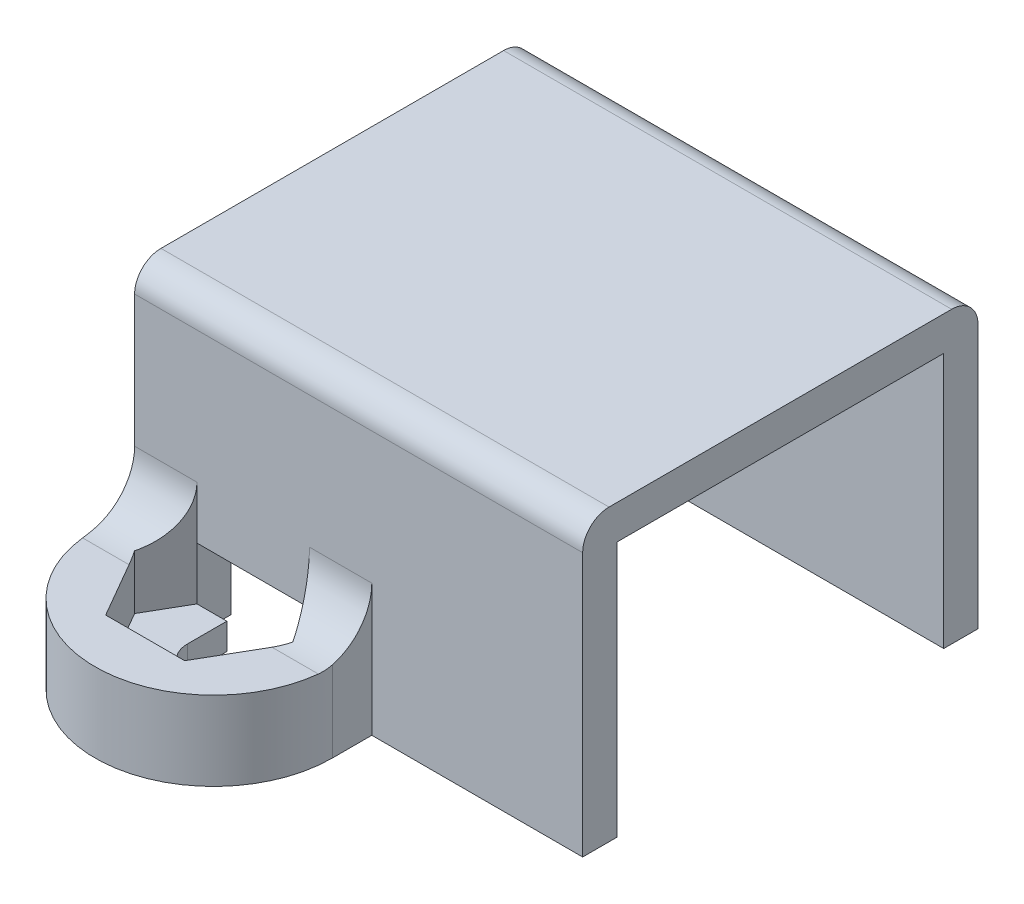
from build123d import *

# Parameters (mm, degrees)
CROQUIS1_W              = 17
CROQUIS1_H              = 27
SALIENTE_EXTRUIR1_DEPTH = 11
CROQUIS2_W              = 17
CROQUIS2_H              = 6
CORTAR_EXTRUIR1_DEPTH   = 6
CROQUIS3_W              = 8
CROQUIS3_H              = 5
CORTAR_EXTRUIR2_DEPTH   = 6
CROQUIS4_W              = 8
CROQUIS4_H              = 5
CORTAR_EXTRUIR3_DEPTH   = 6
CORTAR_EXTRUIR8_DEPTH   = 6
CORTAR_EXTRUIR16_DEPTH  = 2
CORTAR_EXTRUIR17_DEPTH  = 2
CORTAR_EXTRUIR18_DEPTH  = 2
REDONDEO5_START         = -1
REDONDEO5_DEPTH         = 1.04658
REDONDEO5_START_2       = -7.65058
REDONDEO5_2_DEPTH       = 0.804
REDONDEO5_START_3       = -1.866025504
REDONDEO5_3_DEPTH       = 2.366025504
REDONDEO5_START_4       = -8.5
REDONDEO5_4_DEPTH       = 0.84942
REDONDEO5_START_5       = -6.84658
REDONDEO5_5_DEPTH       = 0.712605404
REDONDEO5_START_6       = 3
REDONDEO5_6_DEPTH       = 3
CORTAR_EXTRUIR19_DEPTH  = 17
CORTAR_EXTRUIR20_START  = -10
CORTAR_EXTRUIR20_DEPTH  = 10
REDONDEO6_R             = 1
CORTAR_EXTRUIR21_DEPTH  = 1
CORTAR_EXTRUIR22_DEPTH  = 1
CORTAR_EXTRUIR26_DEPTH  = 1.3
CROQUIS17_W             = 4.267949192
CROQUIS17_H             = 2
CORTAR_EXTRUIR27_DEPTH  = 1.3
CROQUIS19_W             = 4.267949192
CROQUIS19_H             = 1
CORTAR_EXTRUIR28_DEPTH  = 1.3
CROQUIS20_W             = 4.267949192
CROQUIS20_H             = 1
CORTAR_EXTRUIR29_DEPTH  = 1.3


with BuildPart() as part:
    # Croquis1 → Saliente-Extruir1 (new body)
    with BuildSketch(Plane(origin=(0, 0, 0), x_dir=(1, 0, 0), z_dir=(0, 1, 0))):
        Rectangle(CROQUIS1_W, CROQUIS1_H)
    extrude(amount=SALIENTE_EXTRUIR1_DEPTH)

    # Croquis2 → Cortar-Extruir1 (cut)
    with BuildSketch(Plane(origin=(0, 11, 0), x_dir=(1, 0, 0), z_dir=(0, 1, 0))):
        with Locations((0, 10.5)):
            Rectangle(CROQUIS2_W, CROQUIS2_H)
        with Locations((0, -10.5)):
            Rectangle(CROQUIS2_W, CROQUIS2_H)
    extrude(amount=-CORTAR_EXTRUIR1_DEPTH, mode=Mode.SUBTRACT)

    # Croquis3 → Cortar-Extruir2 (cut)
    with BuildSketch(Plane.XY.offset(13.5)):
        with Locations((4.5, 2.5)):
            Rectangle(CROQUIS3_W, CROQUIS3_H)
    extrude(amount=-CORTAR_EXTRUIR2_DEPTH, mode=Mode.SUBTRACT)

    # Croquis4 → Cortar-Extruir3 (cut)
    with BuildSketch(Plane(origin=(0, 0, -13.5), x_dir=(-1, 0, 0), z_dir=(0, 0, -1))):
        with Locations((-4.5, 2.5)):
            Rectangle(CROQUIS4_W, CROQUIS4_H)
    extrude(amount=-CORTAR_EXTRUIR3_DEPTH, mode=Mode.SUBTRACT)

    # Croquis5 → Cortar-Extruir8 (cut)
    with BuildSketch(Plane(origin=(0, 5, 0), x_dir=(1, 0, 0), z_dir=(0, 1, 0))):
        with BuildLine():
            Line((-8.5, 13.5), (-8.5, 9))
            ThreePointArc((-8.5, 9), (-7.181980515, 12.181980515), (-4, 13.5))
            Line((-4, 13.5), (-8.5, 13.5))
        make_face()
        with BuildLine():
            Line((0.5, 13.5), (-4, 13.5))
            ThreePointArc((-4, 13.5), (-0.818019485, 12.181980515), (0.5, 9))
            Line((0.5, 9), (0.5, 13.5))
        make_face()
        with BuildLine():
            ThreePointArc((-4, -13.5), (-7.181980515, -12.181980515), (-8.5, -9))
            Line((-8.5, -9), (-8.5, -13.5))
            Line((-8.5, -13.5), (-4, -13.5))
        make_face()
        with BuildLine():
            ThreePointArc((0.5, -9), (-0.818019485, -12.181980515), (-4, -13.5))
            Line((-4, -13.5), (0.5, -13.5))
            Line((0.5, -13.5), (0.5, -9))
        make_face()
    extrude(amount=-CORTAR_EXTRUIR8_DEPTH, mode=Mode.SUBTRACT)

    # Croquis7 → Cortar-Extruir16 (cut)
    with BuildSketch(Plane(origin=(0, 5, 0), x_dir=(1, 0, 0), z_dir=(0, 1, 0))):
        with BuildLine():
            Line((-8.5, 7.5), (-8.5, 9))
            ThreePointArc((-8.5, 9), (-4, 13.5), (0.5, 9))
            Line((0.5, 9), (0.5, 7.5))
            Line((0.5, 7.5), (-8.5, 7.5))
        make_face()
        with BuildLine():
            Line((-8.5, -9), (-8.5, -7.5))
            Line((-8.5, -7.5), (0.5, -7.5))
            Line((0.5, -7.5), (0.5, -9))
            ThreePointArc((0.5, -9), (-4, -13.5), (-8.5, -9))
        make_face()
    extrude(amount=-CORTAR_EXTRUIR16_DEPTH, mode=Mode.SUBTRACT)

    # Croquis10 → Cortar-Extruir17 (cut)
    with BuildSketch(Plane(origin=(0, 3, 0), x_dir=(1, 0, 0), z_dir=(0, 1, 0))):
        Polygon((-6.133974596, 7.5), (-1.866025404, 7.5), (-1, 9), (-2.5, 11.598076211), (-5.5, 11.598076211), (-7, 9), align=None)
    extrude(amount=-CORTAR_EXTRUIR17_DEPTH, mode=Mode.SUBTRACT)

    # Croquis11 → Cortar-Extruir18 (cut)
    with BuildSketch(Plane(origin=(0, 3, 0), x_dir=(1, 0, 0), z_dir=(0, 1, 0))):
        Polygon((-6.133974596, -7.5), (-1.866025404, -7.5), (-1, -9), (-2.5, -11.598076211), (-5.5, -11.598076211), (-7, -9), align=None)
    extrude(amount=-CORTAR_EXTRUIR18_DEPTH, mode=Mode.SUBTRACT)

    # Redondeo5: read off the stored shape, not the designer's step
    # Redondeo5 outline → Redondeo5 (add)
    with BuildSketch(Plane.YZ.offset(REDONDEO5_START)):
        with BuildLine():
            Line((3, 7.5), (5, 7.5))
            ThreePointArc((5, 7.5), (3.585786438, 8.085786438), (3, 9.5))
            Line((3, 9.5), (3, 7.5))
        make_face()
        with BuildLine():
            ThreePointArc((3, -9.5), (3.585786438, -8.085786438), (5, -7.5))
            Line((5, -7.5), (3, -7.5))
            Line((3, -7.5), (3, -9.5))
        make_face()
    extrude(amount=REDONDEO5_DEPTH)

    # Redondeo5 2 outline → Redondeo5 2 (add)
    with BuildSketch(Plane.YZ.offset(REDONDEO5_START_2)):
        with BuildLine():
            Line((3, 7.5), (5, 7.5))
            ThreePointArc((5, 7.5), (3.585786438, 8.085786438), (3, 9.5))
            Line((3, 9.5), (3, 7.5))
        make_face()
        with BuildLine():
            ThreePointArc((3, -9.5), (3.585786438, -8.085786438), (5, -7.5))
            Line((5, -7.5), (3, -7.5))
            Line((3, -7.5), (3, -9.5))
        make_face()
    extrude(amount=REDONDEO5_2_DEPTH)

    # Redondeo5 3 outline → Redondeo5 3 (add)
    with BuildSketch(Plane.YZ.offset(REDONDEO5_START_3)):
        with BuildLine():
            Line((3, 7.5), (5, 7.5))
            ThreePointArc((5, 7.5), (3.585786438, 8.085786438), (3, 9.5))
            Line((3, 9.5), (3, 7.5))
        make_face()
        with BuildLine():
            ThreePointArc((3, -9.5), (3.585786438, -8.085786438), (5, -7.5))
            Line((5, -7.5), (3, -7.5))
            Line((3, -7.5), (3, -9.5))
        make_face()
    extrude(amount=REDONDEO5_3_DEPTH)

    # Redondeo5 4 outline → Redondeo5 4 (add)
    with BuildSketch(Plane.YZ.offset(REDONDEO5_START_4)):
        with BuildLine():
            Line((3, 7.5), (5, 7.5))
            ThreePointArc((5, 7.5), (3.585786438, 8.085786438), (3, 9.5))
            Line((3, 9.5), (3, 7.5))
        make_face()
        with BuildLine():
            ThreePointArc((3, -9.5), (3.585786438, -8.085786438), (5, -7.5))
            Line((5, -7.5), (3, -7.5))
            Line((3, -7.5), (3, -9.5))
        make_face()
    extrude(amount=REDONDEO5_4_DEPTH)

    # Redondeo5 5 outline → Redondeo5 5 (add)
    with BuildSketch(Plane.YZ.offset(REDONDEO5_START_5)):
        with BuildLine():
            Line((3, 7.5), (5, 7.5))
            ThreePointArc((5, 7.5), (3.585786438, 8.085786438), (3, 9.5))
            Line((3, 9.5), (3, 7.5))
        make_face()
        with BuildLine():
            ThreePointArc((3, -9.5), (3.585786438, -8.085786438), (5, -7.5))
            Line((5, -7.5), (3, -7.5))
            Line((3, -7.5), (3, -9.5))
        make_face()
    extrude(amount=REDONDEO5_5_DEPTH)

    # Redondeo5 6 outline → Redondeo5 6 (cut)
    with BuildSketch(Plane(origin=(0, 0, 0), x_dir=(1, 0, 0), z_dir=(0, 1, 0)).offset(REDONDEO5_START_6)):
        with BuildLine():
            ThreePointArc((0.472135955, 9.5), (0.493028589, 9.250387902), (0.5, 9))
            Line((0.5, 9), (0.5, 9.5))
            Line((0.5, 9.5), (0.472135955, 9.5))
        make_face()
        Polygon((-7, 9), (-6.133974596, 7.5), (-6.133974596, 9.5), (-6.711324865, 9.5), align=None)
        Polygon((-1.866025504, 9.5), (-1.866025504, 7.5), (-1, 9), (-1.288675135, 9.5), align=None)
        with BuildLine():
            Line((-8.5, 9.5), (-8.5, 9))
            ThreePointArc((-8.5, 9), (-8.493028589, 9.250387902), (-8.472135955, 9.5))
            Line((-8.472135955, 9.5), (-8.5, 9.5))
        make_face()
        with BuildLine():
            Line((-8.5, -9), (-8.5, -9.5))
            Line((-8.5, -9.5), (-8.472135955, -9.5))
            ThreePointArc((-8.472135955, -9.5), (-8.493028589, -9.250387902), (-8.5, -9))
        make_face()
        Polygon((-1.866025504, -9.5), (-1.288675135, -9.5), (-1, -9), (-1.866025404, -7.5), align=None)
        Polygon((-6.711324865, -9.5), (-6.133974596, -9.5), (-6.133974596, -7.5), (-7, -9), align=None)
        with BuildLine():
            ThreePointArc((0.5, -9), (0.493028589, -9.250387902), (0.472135955, -9.5))
            Line((0.472135955, -9.5), (0.5, -9.5))
            Line((0.5, -9.5), (0.5, -9))
        make_face()
    extrude(amount=REDONDEO5_6_DEPTH, mode=Mode.SUBTRACT)

    # Croquis12 → Cortar-Extruir19 (cut)
    with BuildSketch(Plane.ZY.offset(8.5)):
        with BuildLine():
            Line((-6.2, 0), (6.2, 0))
            Line((6.2, 0), (6.2, 7.7))
            ThreePointArc((6.2, 7.7), (5.614213562, 9.114213562), (4.2, 9.7))
            Line((4.2, 9.7), (-4.2, 9.7))
            ThreePointArc((-4.2, 9.7), (-5.614213562, 9.114213562), (-6.2, 7.7))
            Line((-6.2, 7.7), (-6.2, 0))
        make_face()
    extrude(amount=-CORTAR_EXTRUIR19_DEPTH, mode=Mode.SUBTRACT)

    # Croquis13 → Cortar-Extruir20 (cut)
    with BuildSketch(Plane(origin=(8.5, 0, 0), x_dir=(0, 0, -1), z_dir=(1, 0, 0)).offset(CORTAR_EXTRUIR20_START)):
        with BuildLine():
            Line((-6.2, 7.7), (-6.2, 9.7))
            Line((-6.2, 9.7), (-4.2, 9.7))
            ThreePointArc((-4.2, 9.7), (-5.614213562, 9.114213562), (-6.2, 7.7))
        make_face()
        with BuildLine():
            Line((6.2, 7.7), (6.2, 9.7))
            Line((6.2, 9.7), (4.2, 9.7))
            ThreePointArc((4.2, 9.7), (5.614213562, 9.114213562), (6.2, 7.7))
        make_face()
    extrude(amount=CORTAR_EXTRUIR20_DEPTH, mode=Mode.SUBTRACT)

    # Redondeo6
    redondeo6_edges = [part.edges().sort_by_distance(p)[0] for p in [
        (0, 11, -7.5),
        (0, 11, 7.5),
    ]]
    fillet(redondeo6_edges, radius=REDONDEO6_R)

    # Croquis14 → Cortar-Extruir21 (cut)
    with BuildSketch(Plane(origin=(0, 1, 0), x_dir=(1, 0, 0), z_dir=(0, 1, 0))):
        with BuildLine():
            Line((-5, 9), (-5, 7.5))
            Line((-5, 7.5), (-3, 7.5))
            Line((-3, 7.5), (-3, 9))
            ThreePointArc((-3, 9), (-4, 10), (-5, 9))
        make_face()
    extrude(amount=-CORTAR_EXTRUIR21_DEPTH, mode=Mode.SUBTRACT)

    # Croquis15 → Cortar-Extruir22 (cut)
    with BuildSketch(Plane(origin=(0, 1, 0), x_dir=(1, 0, 0), z_dir=(0, 1, 0))):
        with BuildLine():
            Line((-5, -9), (-5, -7.5))
            Line((-5, -7.5), (-3, -7.5))
            Line((-3, -7.5), (-3, -9))
            ThreePointArc((-3, -9), (-4, -10), (-5, -9))
        make_face()
    extrude(amount=-CORTAR_EXTRUIR22_DEPTH, mode=Mode.SUBTRACT)

    # Croquis16 → Cortar-Extruir26 (cut)
    with BuildSketch(Plane(origin=(0, 0, -7.5), x_dir=(-1, 0, 0), z_dir=(0, 0, -1))):
        Polygon((1.866025404, 3), (6.133974596, 3), (6.133974596, 1), (5, 1), (3, 1), (1.866025404, 1), align=None)
    extrude(amount=-CORTAR_EXTRUIR26_DEPTH, mode=Mode.SUBTRACT)

    # Croquis17 → Cortar-Extruir27 (cut)
    with BuildSketch(Plane.XY.offset(7.5)):
        with Locations((-4, 2)):
            Rectangle(CROQUIS17_W, CROQUIS17_H)
    extrude(amount=-CORTAR_EXTRUIR27_DEPTH, mode=Mode.SUBTRACT)

    # Croquis19 → Cortar-Extruir28 (cut)
    with BuildSketch(Plane(origin=(0, 0, 6.2), x_dir=(-1, 0, 0), z_dir=(0, 0, -1))):
        with Locations((4, 0.5)):
            Rectangle(CROQUIS19_W, CROQUIS19_H)
    extrude(amount=-CORTAR_EXTRUIR28_DEPTH, mode=Mode.SUBTRACT)

    # Croquis20 → Cortar-Extruir29 (cut)
    with BuildSketch(Plane.XY.offset(-6.2)):
        with Locations((-4, 0.5)):
            Rectangle(CROQUIS20_W, CROQUIS20_H)
    extrude(amount=-CORTAR_EXTRUIR29_DEPTH, mode=Mode.SUBTRACT)


solid = part.part
